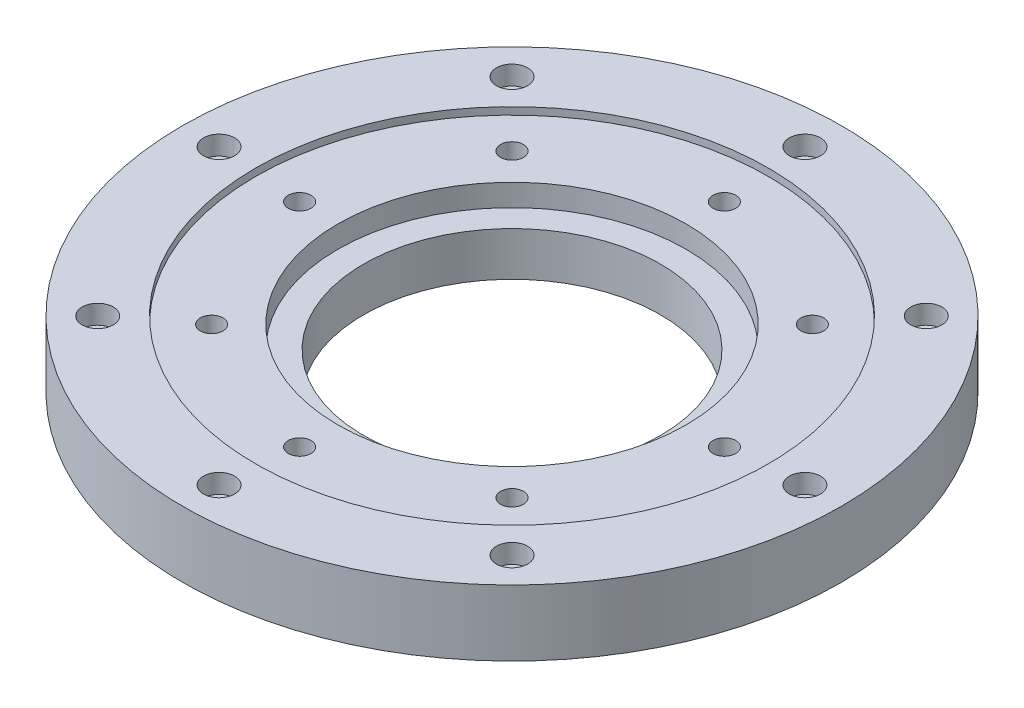
from build123d import *

# Parameters (mm, degrees)
ESQUISSE2_R             = 3.1
ENL_V_MAT_EXTRU_1_DEPTH = 129.840987267
ESQUISSE3_R             = 70
ENL_V_MAT_EXTRU_2_DEPTH = 2
ESQUISSE4_R             = 2.6
ENL_V_MAT_EXTRU_3_DEPTH = 129.840987267
ESQUISSE5_R             = 4.25
ENL_V_MAT_EXTRU_4_DEPTH = 5.2


with BuildPart() as part:
    # Esquisse1 → Révolution1 (revolve)
    with BuildSketch(Plane.XY):
        Polygon((-40.55, 0), (-40.55, 12), (-47.55, 12), (-47.55, 20), (-65, 20), (-90, 20), (-90, 2), (-65, 2), (-65, 0), (-50.3, 0), (-50.3, 6), (-47.1, 6), (-47.1, 0), align=None)
    revolve(axis=Axis((0, 0, 0), (0, 1, 0)))

    # Esquisse2 → Enlèv. mat.-Extru.1 (cut, through all)
    with BuildSketch(Plane.XZ):
        with Locations((0, 58)):
            Circle(ESQUISSE2_R)
        with Locations((41.012193309, 41.012193309)):
            Circle(ESQUISSE2_R)
        with Locations((58, 0)):
            Circle(ESQUISSE2_R)
        with Locations((41.012193309, -41.012193309)):
            Circle(ESQUISSE2_R)
        with Locations((0, -58)):
            Circle(ESQUISSE2_R)
        with Locations((-41.012193309, -41.012193309)):
            Circle(ESQUISSE2_R)
        with Locations((-58, 0)):
            Circle(ESQUISSE2_R)
        with Locations((-41.012193309, 41.012193309)):
            Circle(ESQUISSE2_R)
    extrude(amount=-ENL_V_MAT_EXTRU_1_DEPTH, mode=Mode.SUBTRACT)

    # Esquisse3 → Enlèv. mat.-Extru.2 (cut)
    with BuildSketch(Plane(origin=(0, 20, 0), x_dir=(1, 0, 0), z_dir=(0, 1, 0))):
        Circle(ESQUISSE3_R)
    extrude(amount=-ENL_V_MAT_EXTRU_2_DEPTH, mode=Mode.SUBTRACT)

    # Esquisse4 → Enlèv. mat.-Extru.3 (cut, through all)
    with BuildSketch(Plane(origin=(0, 20, 0), x_dir=(1, 0, 0), z_dir=(0, 1, 0))):
        with Locations((0, 80)):
            Circle(ESQUISSE4_R)
        with Locations((56.568542495, 56.568542495)):
            Circle(ESQUISSE4_R)
        with Locations((80, 0)):
            Circle(ESQUISSE4_R)
        with Locations((56.568542495, -56.568542495)):
            Circle(ESQUISSE4_R)
        with Locations((0, -80)):
            Circle(ESQUISSE4_R)
        with Locations((-56.568542495, -56.568542495)):
            Circle(ESQUISSE4_R)
        with Locations((-80, 0)):
            Circle(ESQUISSE4_R)
        with Locations((-56.568542495, 56.568542495)):
            Circle(ESQUISSE4_R)
    extrude(amount=-ENL_V_MAT_EXTRU_3_DEPTH, mode=Mode.SUBTRACT)

    # Esquisse5 → Enlèv. mat.-Extru.4 (cut)
    with BuildSketch(Plane(origin=(0, 20, 0), x_dir=(1, 0, 0), z_dir=(0, 1, 0))):
        with Locations((0, 80)):
            Circle(ESQUISSE5_R)
        with Locations((56.568542495, 56.568542495)):
            Circle(ESQUISSE5_R)
        with Locations((80, 0)):
            Circle(ESQUISSE5_R)
        with Locations((56.568542495, -56.568542495)):
            Circle(ESQUISSE5_R)
        with Locations((0, -80)):
            Circle(ESQUISSE5_R)
        with Locations((-56.568542495, -56.568542495)):
            Circle(ESQUISSE5_R)
        with Locations((-80, 0)):
            Circle(ESQUISSE5_R)
        with Locations((-56.568542495, 56.568542495)):
            Circle(ESQUISSE5_R)
    extrude(amount=-ENL_V_MAT_EXTRU_4_DEPTH, mode=Mode.SUBTRACT)


solid = part.part
